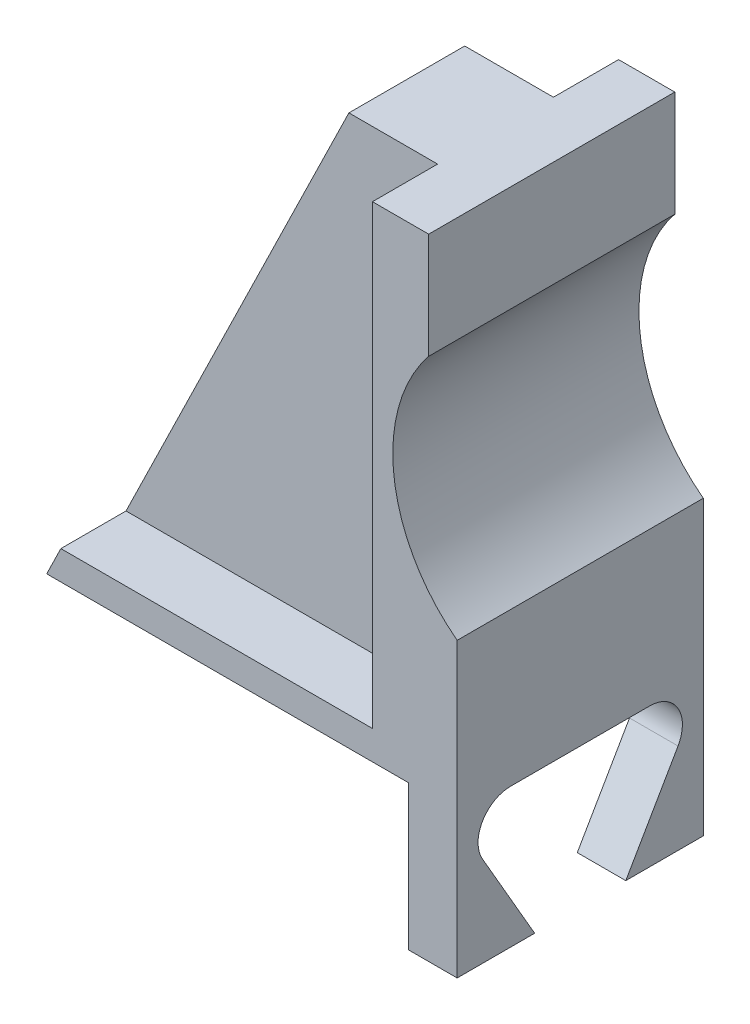
from build123d import *

# Parameters (mm, degrees)
BOSS_EXTRUDE2_DEPTH = 34
SKETCH5_W           = 50
SKETCH5_H           = 20
CUT_EXTRUDE1_DEPTH  = 9
SKETCH6_W           = 50
SKETCH6_H           = 20
CUT_EXTRUDE2_DEPTH  = 9
SKETCH7_W           = 52.006330756
SKETCH7_H           = 21.627895193
CUT_EXTRUDE3_DEPTH  = 87.963406183
CUT_EXTRUDE4_DEPTH  = 102.507335876


with BuildPart() as part:
    # Sketch4 → Boss-Extrude2 (new body)
    with BuildSketch(Plane.XY):
        with BuildLine():
            Line((-25, -10), (31.702104436, -10))
            Line((31.702104436, -10), (31.702104436, 30.398563958))
            ThreePointArc((31.702104436, 30.398563958), (22.978895732, 45.572200501), (27.765437219, 62.407361226))
            Line((27.765437219, 62.407361226), (27.765437219, 77.023441816))
            Line((27.765437219, 77.023441816), (7.747226033, 77.023441816))
            Line((7.747226033, 77.023441816), (-25, 10))
            Line((-25, 10), (-25, -10))
        make_face()
    extrude(amount=BOSS_EXTRUDE2_DEPTH)

    # Sketch5 → Cut-Extrude1 (cut)
    with BuildSketch(Plane.XY.offset(34)):
        Polygon((-23.045625522, 14), (7.747226033, 77.023441816), (20, 77.023441816), (20, 14), align=None)
        Rectangle(SKETCH5_W, SKETCH5_H)
    extrude(amount=-CUT_EXTRUDE1_DEPTH, mode=Mode.SUBTRACT)

    # Sketch6 → Cut-Extrude2 (cut)
    with BuildSketch(Plane(origin=(0, 0, 0), x_dir=(-1, 0, 0), z_dir=(0, 0, -1))):
        Polygon((23.045625522, 14), (-20, 14), (-20, 77.023441816), (-7.747226033, 77.023441816), align=None)
        Rectangle(SKETCH6_W, SKETCH6_H)
    extrude(amount=-CUT_EXTRUDE2_DEPTH, mode=Mode.SUBTRACT)

    # Sketch7 → Cut-Extrude3 (cut, through all)
    with BuildSketch(Plane(origin=(0, 0, 9), x_dir=(-1, 0, 0), z_dir=(0, 0, -1))):
        with Locations((1.003165378, -0.813947597)):
            Rectangle(SKETCH7_W, SKETCH7_H)
    extrude(amount=-CUT_EXTRUDE3_DEPTH, mode=Mode.SUBTRACT)

    # Sketch9 → Cut-Extrude4 (cut, through all)
    with BuildSketch(Plane(origin=(31.702104436, 0, 0), x_dir=(0, 0, -1), z_dir=(1, 0, 0))):
        with BuildLine():
            Line((-26.615, 9.249281979), (-7.385, 9.249281979))
            ThreePointArc((-7.385, 9.249281979), (-3.487778361, 6.999096082), (-3.488100353, 2.498910201))
            Line((-3.488100353, 2.498910201), (-13.103100353, -14.151089799))
            ThreePointArc((-13.103100353, -14.151089799), (-17, -16.400718021), (-20.896899647, -14.151089799))
            Line((-20.896899647, -14.151089799), (-30.511899647, 2.498910201))
            ThreePointArc((-30.511899647, 2.498910201), (-30.512221639, 6.999096082), (-26.615, 9.249281979))
        make_face()
    extrude(amount=-CUT_EXTRUDE4_DEPTH, mode=Mode.SUBTRACT)


solid = part.part
